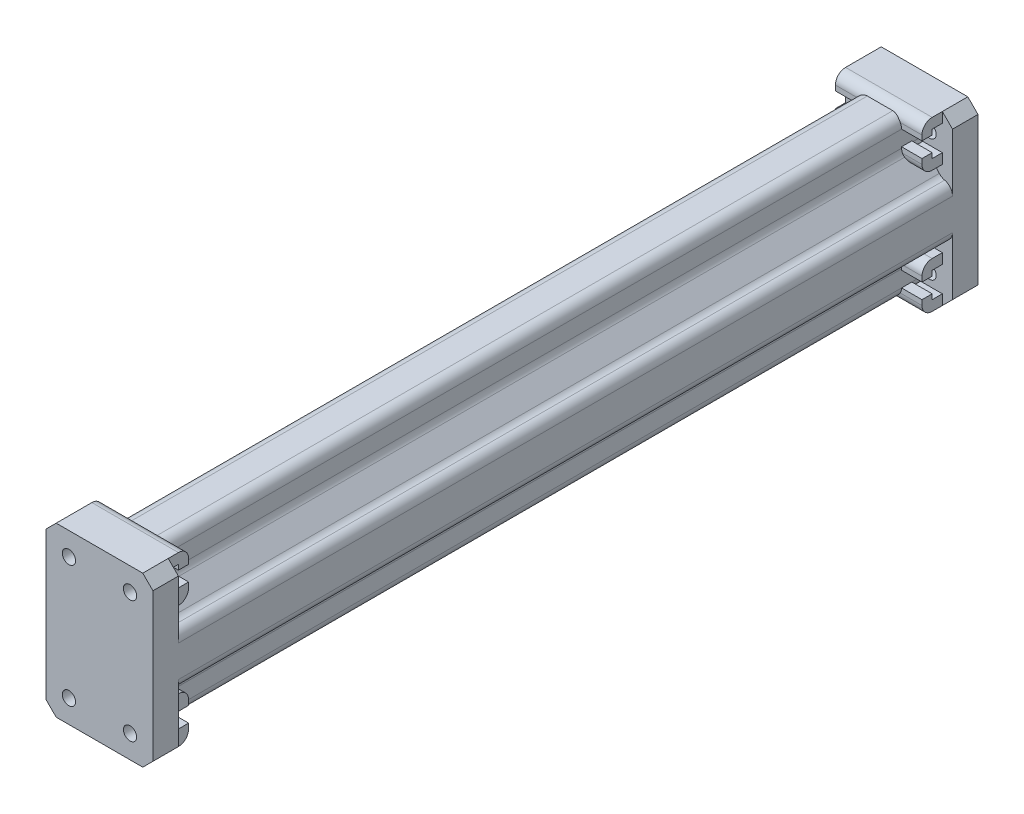
from build123d import *

# Parameters (mm, degrees)
SKETCH1_R                                = 1.3000000000000003
SKETCH1_R_2                              = 8.999999999999996
BOSS_EXTRUDE1_DEPTH                      = 5
BOSS_EXTRUDE2_DEPTH                      = 76
FILLET1_R                                = 2
BOSS_EXTRUDE9_START                      = -5
BOSS_EXTRUDE9_DEPTH                      = 9
MIRROR8_START                            = -5
MIRROR8_AT_THE_SECOND_PLANE_COPY_1_DEPTH = 9


with BuildPart() as part:
    # Sketch1 → Boss-Extrude1 (new body)
    # profile 1 of 2: a face of its own
    with BuildSketch(Plane.XY):
        Polygon((-8.499999999999996, -16.5), (8.499999999999996, -16.5), (10.499999999999996, -14.5), (10.500000000000004, 14.5), (8.499999999999996, 16.499999999999993), (-8.499999999999996, 16.5), (-10.499999999999996, 14.5), (-10.499999999999996, -14.5), align=None)
        with Locations((-5.999999999999991, -11.999999999999998)):
            Circle(SKETCH1_R, mode=Mode.SUBTRACT)
        with Locations((5.999999999999998, -11.999999999999998)):
            Circle(SKETCH1_R, mode=Mode.SUBTRACT)
        Circle(SKETCH1_R_2, mode=Mode.SUBTRACT)
        with Locations((-5.999999999999995, 11.999999999999998)):
            Circle(SKETCH1_R, mode=Mode.SUBTRACT)
        with Locations((5.999999999999995, 11.999999999999998)):
            Circle(SKETCH1_R, mode=Mode.SUBTRACT)
    # profile 2 of 2: a face of its own
    with BuildSketch(Plane.XY):
        Circle(SKETCH1_R_2)
    extrude(amount=BOSS_EXTRUDE1_DEPTH)

    # Sketch2 → Boss-Extrude2 (add)
    with BuildSketch(Plane.XY.offset(5)):
        with BuildLine():
            Line((-2.5, 15.5), (2.4999999999999925, 15.5))
            ThreePointArc((2.4999999999999925, 15.5), (3.914213562373087, 14.914213562373094), (4.499999999999992, 13.5))
            Line((4.499999999999992, 13.5), (4.4999999999999964, 10.260398644698075))
            ThreePointArc((4.4999999999999964, 10.260398644698075), (4.630556596907162, 9.549637529672301), (5.005181362632678, 8.931670967038235))
            Line((5.005181362632678, 8.931670967038235), (7.903313491253191, 5.67127232234016))
            ThreePointArc((7.903313491253191, 5.67127232234016), (8.578820025487547, 5.175519888390164), (9.39813212862051, 5))
            Line((9.39813212862051, 5), (10.500000000000004, 5.000000000000156))
            Line((10.500000000000004, 5.000000000000156), (10.500000000000004, -4.999999999999844))
            Line((10.500000000000004, -4.999999999999844), (9.39813212862051, -5))
            ThreePointArc((9.39813212862051, -5), (8.578820025487547, -5.175519888390164), (7.903313491253191, -5.67127232234016))
            Line((7.903313491253191, -5.67127232234016), (5.005181362632678, -8.931670967038235))
            ThreePointArc((5.005181362632678, -8.931670967038235), (4.630556596907162, -9.549637529672301), (4.4999999999999964, -10.260398644698075))
            Line((4.4999999999999964, -10.260398644698075), (4.499999999999997, -13.499999999999988))
            ThreePointArc((4.499999999999997, -13.499999999999988), (3.9142135623730896, -14.914213562373082), (2.4999999999999956, -15.499999999999986))
            Line((2.4999999999999956, -15.499999999999986), (-2.4999999999999956, -15.499999999999986))
            ThreePointArc((-2.4999999999999956, -15.499999999999986), (-3.9142135623730896, -14.914213562373082), (-4.499999999999997, -13.499999999999988))
            Line((-4.499999999999997, -13.499999999999988), (-4.4999999999999964, -10.260398644698075))
            ThreePointArc((-4.4999999999999964, -10.260398644698075), (-4.630556596907162, -9.549637529672301), (-5.005181362632678, -8.931670967038235))
            Line((-5.005181362632678, -8.931670967038235), (-7.903313491253191, -5.67127232234016))
            ThreePointArc((-7.903313491253191, -5.67127232234016), (-8.578820025487547, -5.175519888390164), (-9.39813212862051, -5))
            Line((-9.39813212862051, -5), (-10.500000000000002, -4.999999999999844))
            Line((-10.500000000000002, -4.999999999999844), (-10.500000000000002, 5.000000000000156))
            Line((-10.500000000000002, 5.000000000000156), (-9.398132128620512, 5.000000000000001))
            ThreePointArc((-9.398132128620512, 5.000000000000001), (-8.578820025487548, 5.175519888390164), (-7.903313491253193, 5.67127232234016))
            Line((-7.903313491253193, 5.67127232234016), (-5.00518136263268, 8.931670967038233))
            ThreePointArc((-5.00518136263268, 8.931670967038233), (-4.630556596907164, 9.549637529672301), (-4.499999999999999, 10.260398644698075))
            Line((-4.499999999999999, 10.260398644698075), (-4.5, 13.5))
            ThreePointArc((-4.5, 13.5), (-3.9142135623730945, 14.914213562373096), (-2.5, 15.5))
        make_face()
    extrude(amount=BOSS_EXTRUDE2_DEPTH)

    # Fillet1
    # the kernel refuses this fillet: 2 mm, written as the material it takes off along each edge
    with BuildSketch(Plane(origin=(10.500000000000004, -4.999999999999844, 5), x_dir=(0, 1, 0), z_dir=(0, 0, 1))) as fillet1_piece_1:
        with BuildLine():
            CenterArc((1.8978659134888645, 2), FILLET1_R, 192.97542030205216, 77.02457969794784)
            Line((-0.05106704325564593, 1.5509339356897485), (-0.2459603389300966, 1.506027329258723))
            ThreePointArc((-0.2459603389300966, 1.506027329258723), (-0.20000000000015739, 1.1018678713794934), (-0.20000000000000018, -2.842e-14))
            Line((-0.20000000000000018, -2.842e-14), (0, -0.1999999999999993))
            Line((0, -0.1999999999999993), (1.8978659134888645, -0.1999999999999993))
            Line((1.8978659134888645, -0.1999999999999993), (1.8978659134888645, 0))
        make_face()
    extrude(amount=80.74466478372216, mode=Mode.SUBTRACT)
    with BuildSketch(Plane(origin=(10.500000000000004, 5.000000000000156, 5), x_dir=(0, -1, 0), z_dir=(0, 0, 1))) as fillet1_piece_2:
        with BuildLine():
            CenterArc((1.897865913489177, -2), FILLET1_R, 90, 77.02457969794779)
            Line((-0.05106704325533329, -1.5509339356897467), (-0.24596033892978397, -1.5060273292587212))
            ThreePointArc((-0.24596033892978397, -1.5060273292587212), (-0.19999999999984386, -1.1018678713794934), (-0.20000000000000018, -2.842e-14))
            Line((-0.20000000000000018, -2.842e-14), (0, 0.1999999999999993))
            Line((0, 0.1999999999999993), (1.897865913489177, 0.1999999999999993))
            Line((1.897865913489177, 0.1999999999999993), (1.897865913489177, 0))
        make_face()
    extrude(amount=80.74466478372295, mode=Mode.SUBTRACT)
    with BuildSketch(Plane(origin=(-10.500000000000002, -4.999999999999844, 5), x_dir=(2.81e-15, 1, 0), z_dir=(0, 0, 1))) as fillet1_piece_3:
        with BuildLine():
            CenterArc((1.89786591348887, -2), FILLET1_R, 90.00000000000017, 77.02457969794767)
            Line((-0.05106704325564068, -1.5509339356897487), (-0.2459603389300915, -1.5060273292587236))
            ThreePointArc((-0.2459603389300915, -1.5060273292587236), (-0.20000000000015342, -1.1018678713794923), (-0.20000000000000018, 2.786e-14))
            Line((-0.20000000000000018, 2.786e-14), (-5.6e-16, 0.1999999999999993))
            Line((-5.6e-16, 0.1999999999999993), (1.8978659134888638, 0.1999999999999993))
            Line((1.8978659134888638, 0.1999999999999993), (1.8978659134888645, 0))
        make_face()
    extrude(amount=80.74466478372216, mode=Mode.SUBTRACT)
    with BuildSketch(Plane(origin=(-10.500000000000002, 5.000000000000156, 5), x_dir=(2.81e-15, -1, 0), z_dir=(0, 0, 1))) as fillet1_piece_4:
        with BuildLine():
            CenterArc((1.8978659134891809, 2), FILLET1_R, 192.97542030205216, 77.02457969794767)
            Line((-0.05106704325532982, 1.5509339356897487), (-0.24596033892978064, 1.5060273292587236))
            ThreePointArc((-0.24596033892978064, 1.5060273292587236), (-0.19999999999984167, 1.1018678713794905), (-0.20000000000000018, 2.898e-14))
            Line((-0.20000000000000018, 2.898e-14), (-5.6e-16, -0.1999999999999993))
            Line((-5.6e-16, -0.1999999999999993), (1.8978659134891747, -0.1999999999999993))
            Line((1.8978659134891747, -0.1999999999999993), (1.8978659134891753, 0))
        make_face()
    extrude(amount=80.74466478372294, mode=Mode.SUBTRACT)

    # Sketch7 → Boss-Extrude9 (add)
    with BuildSketch(Plane.ZY.offset(4.4999999999999964).offset(BOSS_EXTRUDE9_START)):
        with BuildLine():
            Line((5.000000000000002, 14.500000000000016), (7.000000000000002, 14.500000000000016))
            Line((7.000000000000002, 14.500000000000016), (7, 13.500000000000016))
            Line((7, 13.500000000000016), (9, 13.500000000000016))
            Line((9, 13.500000000000016), (9, 14.500000000000004))
            ThreePointArc((9, 14.500000000000004), (8.414213562373096, 15.9142135623731), (6.999999999999999, 16.500000000000007))
            Line((6.999999999999999, 16.500000000000007), (5, 16.500000000000004))
            Line((5, 16.500000000000004), (5.000000000000002, 14.500000000000016))
        make_face()
        with BuildLine():
            Line((5.000000000000001, 9.500000000000016), (6.999999999999997, 9.500000000000016))
            Line((6.999999999999997, 9.500000000000016), (7.000000000000003, 10.500000000000016))
            Line((7.000000000000003, 10.500000000000016), (9, 10.500000000000016))
            Line((9, 10.500000000000016), (9, 9.500000000000016))
            ThreePointArc((9, 9.500000000000016), (8.414213562373094, 8.085786437626918), (6.999999999999997, 7.500000000000015))
            Line((6.999999999999997, 7.500000000000015), (5.000000000000001, 7.500000000000014))
            Line((5.000000000000001, 7.500000000000014), (5.000000000000001, 9.500000000000016))
        make_face()
    boss_extrude9 = extrude(amount=BOSS_EXTRUDE9_DEPTH)

    # Mirror8: Boss-Extrude9 across plane
    add(boss_extrude9.mirror(Plane(origin=(0, 0, 0), x_dir=(0, 0, 1), z_dir=(1, 0, 0))))

    # Mirror8 at the second plane: Boss-Extrude9 across plane
    add(boss_extrude9.mirror(Plane.ZX))

    # Mirror8 at the second plane copy 1 sketc → Mirror8 at the second plane copy 1 (add)
    with BuildSketch(Plane(origin=(4.4999999999999964, 1.2e-15, 0), x_dir=(0, 0, 1), z_dir=(1, 2.7e-16, 0)).offset(MIRROR8_START)):
        with BuildLine():
            Line((5.000000000000002, 14.500000000000016), (7.000000000000002, 14.500000000000016))
            Line((7.000000000000002, 14.500000000000016), (7, 13.500000000000016))
            Line((7, 13.500000000000016), (9, 13.500000000000016))
            Line((9, 13.500000000000016), (9, 14.500000000000004))
            ThreePointArc((9, 14.500000000000004), (8.414213562373096, 15.9142135623731), (6.999999999999999, 16.500000000000007))
            Line((6.999999999999999, 16.500000000000007), (5, 16.500000000000004))
            Line((5, 16.500000000000004), (5.000000000000002, 14.500000000000016))
        make_face()
        with BuildLine():
            Line((5.000000000000001, 9.500000000000016), (6.999999999999997, 9.500000000000016))
            Line((6.999999999999997, 9.500000000000016), (7.000000000000003, 10.500000000000016))
            Line((7.000000000000003, 10.500000000000016), (9, 10.500000000000016))
            Line((9, 10.500000000000016), (9, 9.500000000000016))
            ThreePointArc((9, 9.500000000000016), (8.414213562373094, 8.085786437626918), (6.999999999999997, 7.500000000000015))
            Line((6.999999999999997, 7.500000000000015), (5.000000000000001, 7.500000000000014))
            Line((5.000000000000001, 7.500000000000014), (5.000000000000001, 9.500000000000016))
        make_face()
    extrude(amount=MIRROR8_AT_THE_SECOND_PLANE_COPY_1_DEPTH)

    # Mirror6: part across plane


with BuildPart() as part_1:
    add(part.part)
    add(part.part.mirror(Plane(origin=(9.39813212862051, 7, 81), x_dir=(1, 0, 0), z_dir=(0, 0, 1))))


solid = part_1.part
